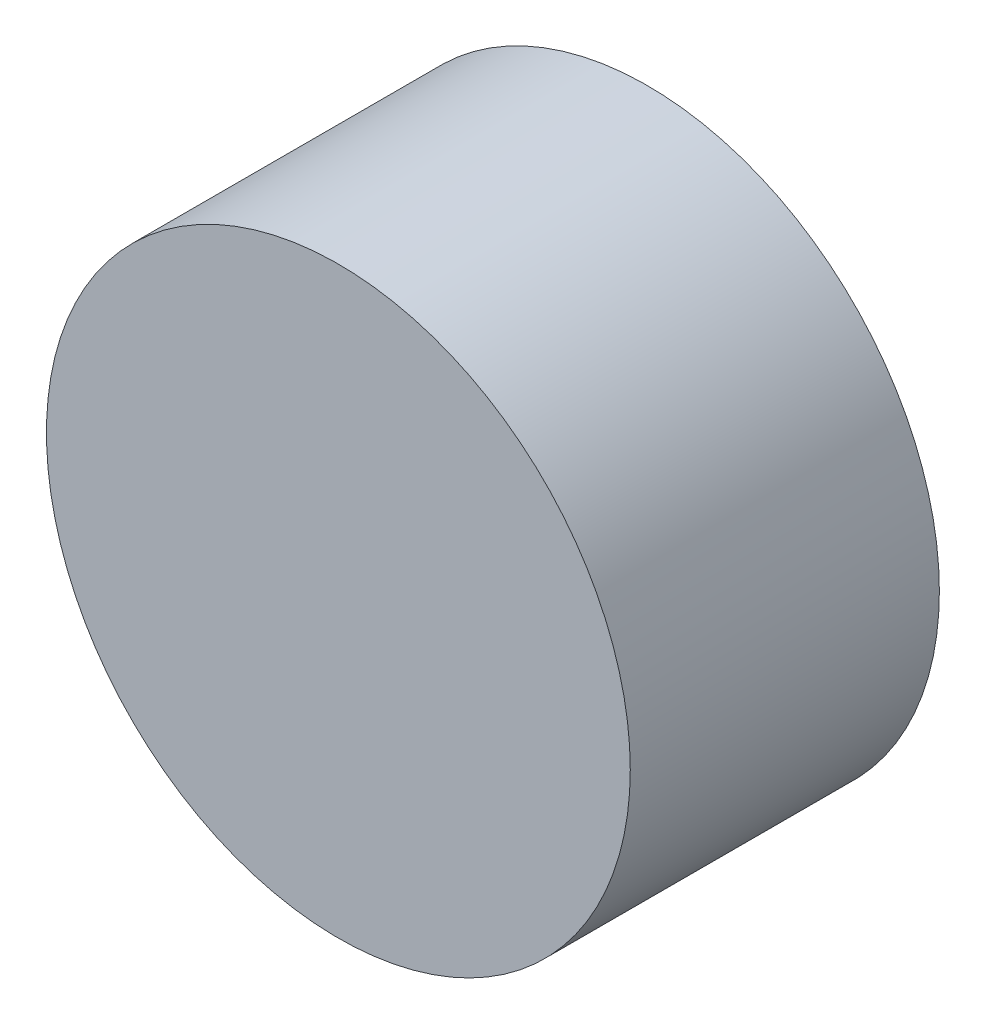
from build123d import *

# Parameters (mm, degrees)
BOSS_EXTRUDE1_DEPTH      = 4.5
BOSS_EXTRUDE1_DEPTH_BACK = 4.5
SKETCH1_R                = 8.5


with BuildPart() as part:
    # Sketch1 → Boss-Extrude1 (new, two sides: drawn at the far end of the back side and taken through both)
    with BuildSketch(Plane.XY.offset(-BOSS_EXTRUDE1_DEPTH_BACK)):
        Circle(SKETCH1_R)
    extrude(amount=BOSS_EXTRUDE1_DEPTH + BOSS_EXTRUDE1_DEPTH_BACK)


solid = part.part
